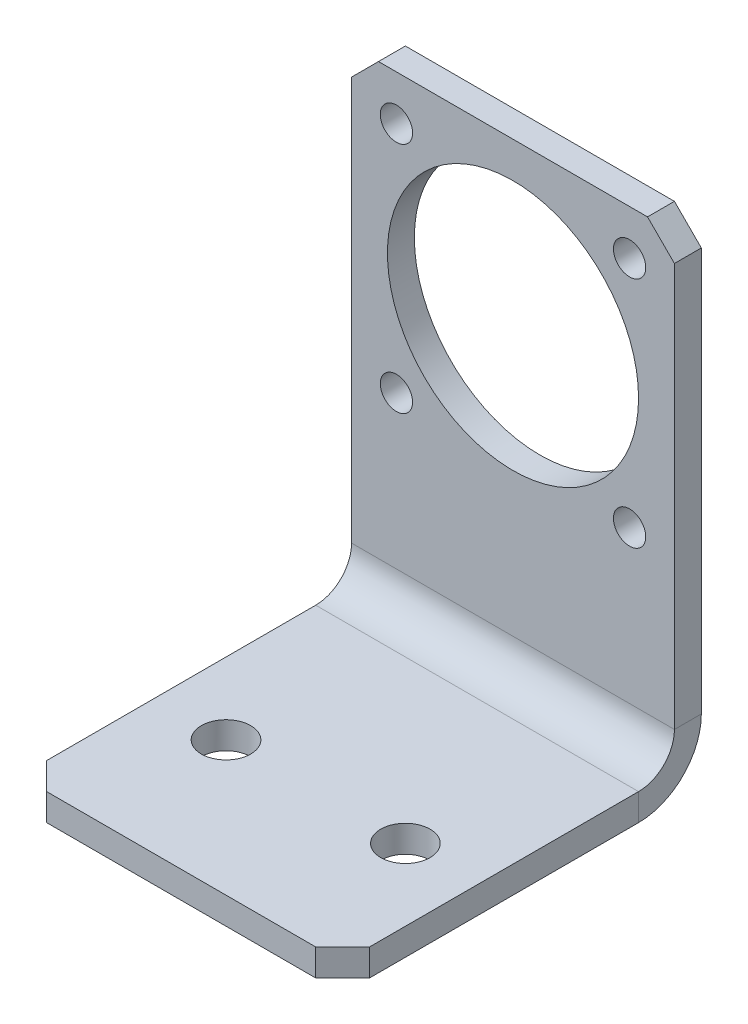
from build123d import *

# Parameters (mm, degrees)
SKETCH_1_W             = 36
SKETCH_1_H             = 89.64
SM_BASE_FLANGE_1_DEPTH = 3
OTHER_START            = -18
OTHER_1_DEPTH          = 36
OTHER_1_2_DEPTH        = 36
SKETCH_7_R             = 14
SKETCH_7_R_2           = 1.8
CUT_EXTRUDE_1_DEPTH    = 10
CHAMFER_1_SIZE         = 3
SKETCH_8_R             = 2.75
CUT_EXTRUDE_2_DEPTH    = 10


# Read off the part's stored shape, not the designer's step: Нарисованный сгиб1
# Sheet-metal steps are written as plain solids
with BuildPart() as part:
    # Sketch 1 → Базовая кромка1 (new body)
    with BuildSketch(Plane(origin=(0, 0, 0), x_dir=(1, 0, 0), z_dir=(0, 1, 0))):
        Rectangle(SKETCH_1_W, SKETCH_1_H)
    extrude(amount=-SM_BASE_FLANGE_1_DEPTH)

    # Other 1 outline → Other 1 (cut)
    with BuildSketch(Plane.YZ.offset(OTHER_START)):
        with BuildLine():
            Line((0, -44.82), (0, 6.075437354))
            ThreePointArc((0, 6.075437354), (-2.204836823, 8.579629651), (-3, 11.82))
            Line((-3, 11.82), (-3, -44.82))
            Line((-3, -44.82), (0, -44.82))
        make_face()
    extrude(amount=OTHER_1_DEPTH, mode=Mode.SUBTRACT)

    # Other 1 2 outline → Other 1 2 (add)
    with BuildSketch(Plane.YZ.offset(OTHER_START)):
        with BuildLine():
            Line((52.000620203, 7.82), (4, 7.82))
            ThreePointArc((4, 7.82), (1.171572875, 8.991572875), (0, 11.82))
            Line((0, 11.82), (0, 6.075437354))
            ThreePointArc((0, 6.075437354), (1.903805654, 5.141229959), (4, 4.82))
            Line((4, 4.82), (52.000620203, 4.82))
            Line((52.000620203, 4.82), (52.000620203, 7.82))
        make_face()
    extrude(amount=OTHER_1_2_DEPTH)

    # Эскиз7 → Вырез-Вытянуть1 (cut)
    with BuildSketch(Plane.XY.offset(7.82)):
        with Locations((0, 34.000620203)):
            Circle(SKETCH_7_R)
        with Locations((13, 47.000620203)):
            Circle(SKETCH_7_R_2)
        with Locations(Location((-13, 47.000620203, 0), (0, 0, 90))):
            Circle(SKETCH_7_R_2)
        with Locations((-13, 21.000620203)):
            Circle(SKETCH_7_R_2)
        with Locations(Location((13, 21.000620203, 0), (0, 0, 90))):
            Circle(SKETCH_7_R_2)
    extrude(amount=-CUT_EXTRUDE_1_DEPTH, mode=Mode.SUBTRACT)

    # Фаска1
    chamfer_1_edges = [part.edges().sort_by_distance(p)[0] for p in [
        (18, -1.5, 44.82),
        (-18, -1.5, 44.82),
        (-18, 52.000620203, 6.32),
        (18, 52.000620203, 6.32),
    ]]
    chamfer(chamfer_1_edges, length=CHAMFER_1_SIZE)

    # Эскиз8 → Вырез-Вытянуть2 (cut)
    with BuildSketch(Plane(origin=(0, 0, 0), x_dir=(1, 0, 0), z_dir=(0, 1, 0))):
        with Locations(Location((-10, -29.82, 0), (0, 0, 270))):
            Circle(SKETCH_8_R)
        with Locations(Location((10, -29.82, 0), (0, 0, 90))):
            Circle(SKETCH_8_R)
    extrude(amount=-CUT_EXTRUDE_2_DEPTH, mode=Mode.SUBTRACT)


solid = part.part
